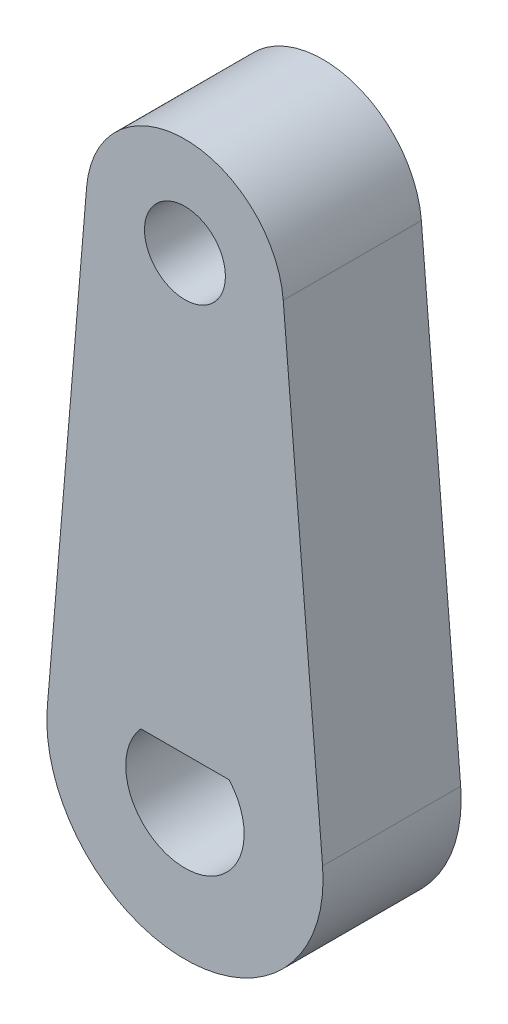
from build123d import *

# Parameters (mm, degrees)
BOSS_EXTRUDE1_DEPTH = 3.5
SKETCH2_R           = 1.025
CUT_EXTRUDE1_DEPTH  = 16.321553446


with BuildPart() as part:
    # Sketch1 → Boss-Extrude1 (new body)
    with BuildSketch(Plane.XY):
        with BuildLine():
            Line((-2.491304321, 12.208333333), (-3.48782605, 0.291666667))
            ThreePointArc((-3.48782605, 0.291666667), (0, -3.5), (3.48782605, 0.291666667))
            Line((3.48782605, 0.291666667), (2.491304321, 12.208333333))
            ThreePointArc((2.491304321, 12.208333333), (0, 14.5), (-2.491304321, 12.208333333))
        make_face()
    extrude(amount=BOSS_EXTRUDE1_DEPTH)

    # Sketch2 → Cut-Extrude1 (cut, through all)
    with BuildSketch(Plane.XY.offset(3.5)):
        with Locations((0, 12)):
            Circle(SKETCH2_R)
        with BuildLine():
            Line((-1.118033989, 1), (1.118033989, 1))
            ThreePointArc((1.118033989, 1), (0, -1.5), (-1.118033989, 1))
        make_face()
    extrude(amount=-CUT_EXTRUDE1_DEPTH, mode=Mode.SUBTRACT)


solid = part.part
